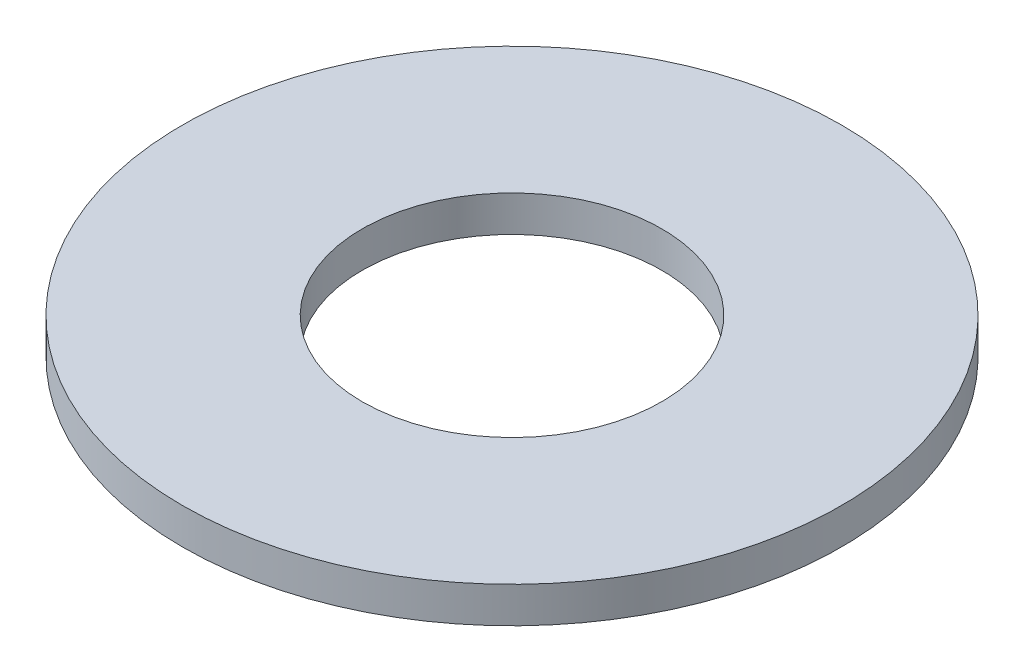
from build123d import *

# Parameters (mm, degrees)
SKETCH1_R           = 82.5
BOSS_EXTRUDE1_DEPTH = 9
SKETCH2_R           = 37.5
CUT_EXTRUDE1_DEPTH  = 118.019229189


with BuildPart() as part:
    # Sketch1 → Boss-Extrude1 (new body)
    with BuildSketch(Plane(origin=(0, 0, 0), x_dir=(1, 0, 0), z_dir=(0, 1, 0))):
        Circle(SKETCH1_R)
    extrude(amount=BOSS_EXTRUDE1_DEPTH)

    # Sketch2 → Cut-Extrude1 (cut, through all)
    with BuildSketch(Plane(origin=(0, 0, 0), x_dir=(1, 0, 0), z_dir=(0, 1, 0))):
        Circle(SKETCH2_R)
    extrude(amount=CUT_EXTRUDE1_DEPTH, mode=Mode.SUBTRACT)


solid = part.part
